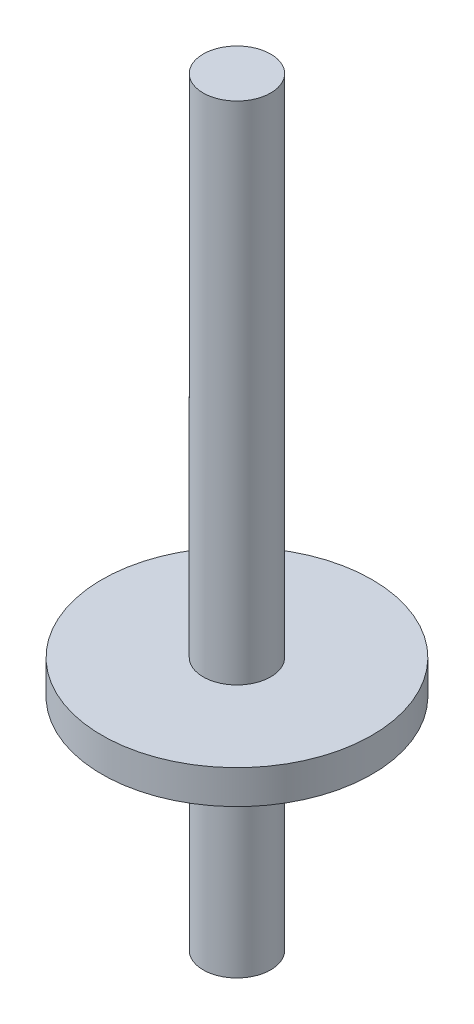
from build123d import *

# Parameters (mm, degrees)
SKETCH1_R           = 10
BOSS_EXTRUDE1_DEPTH = 149.828311793
SKETCH2_R           = 40.000518223
BOSS_EXTRUDE2_DEPTH = 10
BOSS_EXTRUDE3_START = -75.18704951
SKETCH1_2_R         = 10
BOSS_EXTRUDE3_DEPTH = 75.18704951


with BuildPart() as part:
    # Sketch1 → Boss-Extrude1 (new body)
    with BuildSketch(Plane(origin=(0, 0, 0), x_dir=(1, 0, 0), z_dir=(0, 1, 0))):
        Circle(SKETCH1_R)
    extrude(amount=BOSS_EXTRUDE1_DEPTH)

    # Sketch2 → Boss-Extrude2 (add)
    with BuildSketch(Plane(origin=(0, 0, 0), x_dir=(-1, 0, 0), z_dir=(0, -1, 0))):
        Circle(SKETCH2_R)
    extrude(amount=BOSS_EXTRUDE2_DEPTH)

    # Sketch1<2> → Boss-Extrude3 (add)
    with BuildSketch(Plane(origin=(0, 0, 0), x_dir=(1, 0, 0), z_dir=(0, 1, 0)).offset(BOSS_EXTRUDE3_START)):
        Circle(SKETCH1_2_R)
    extrude(amount=BOSS_EXTRUDE3_DEPTH)


solid = part.part
